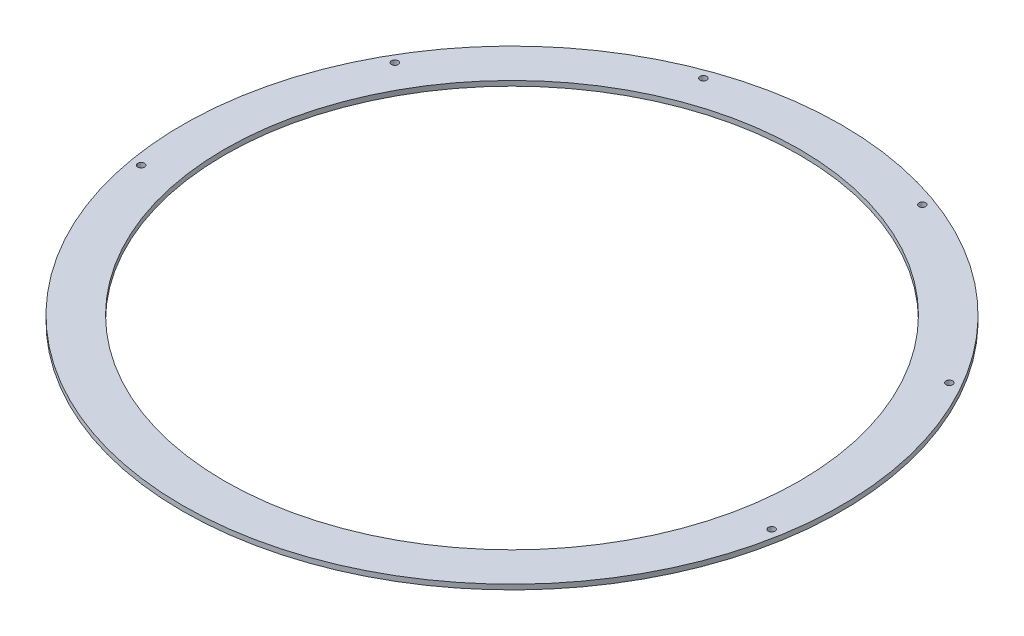
from build123d import *

# Parameters (mm, degrees)
SKIZZE1_R            = 332.5
SKIZZE1_R_2          = 290
BASIS_BLECH1_DEPTH   = 5
M8_GEWINDEBOHRUNG1_D = 6.8


# Sheet-metal steps are written as plain solids
with BuildPart() as part:
    # Skizze1 → Basis-Blech1 (new body)
    with BuildSketch(Plane(origin=(0, 0, 0), x_dir=(1, 0, 0), z_dir=(0, 1, 0))):
        with Locations(Location((0, 0, 0), (0, 0, 270))):
            Circle(SKIZZE1_R)
        with Locations(Location((0, 0, 0), (0, 0, 270))):
            Circle(SKIZZE1_R_2, mode=Mode.SUBTRACT)
    extrude(amount=BASIS_BLECH1_DEPTH)

    # M8 Gewindebohrung1 (through all)
    with Locations(Plane(origin=(0, 5, 0), x_dir=(1, 0, 0), z_dir=(0, 1, 0))):
        with Locations((-318.092904223, -56.088361386), (-279.726205422, 161.5), (-110.472506294, 303.520716514), (110.472506294, 303.520716514), (279.726205422, 161.5), (318.092904223, -56.088361386)):
            Hole(M8_GEWINDEBOHRUNG1_D / 2)


solid = part.part
